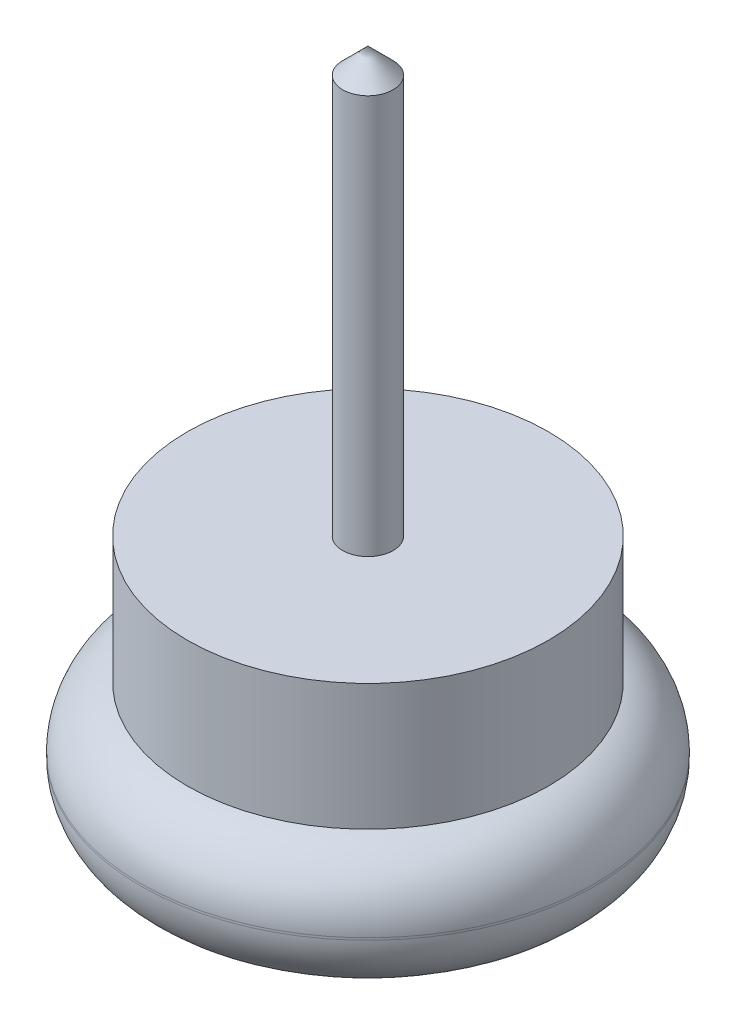
from build123d import *

# Parameters (mm, degrees)
SKETCH1_R           = 9
BOSS_EXTRUDE1_DEPTH = 5
SKETCH2_R           = 7.15
BOSS_EXTRUDE2_DEPTH = 5
SKETCH3_R           = 1
BOSS_EXTRUDE3_DEPTH = 16.8
FILLET1_R           = 2.5
CHAMFER1_SIZE       = 1


with BuildPart() as part:
    # Sketch1 → Boss-Extrude1 (new body)
    with BuildSketch(Plane(origin=(0, 0, 0), x_dir=(1, 0, 0), z_dir=(0, 1, 0))):
        with Locations(Location((0, 0, 0), (0, 0, 270))):
            Circle(SKETCH1_R)
    extrude(amount=BOSS_EXTRUDE1_DEPTH)

    # Sketch2 → Boss-Extrude2 (add)
    with BuildSketch(Plane(origin=(0, 5, 0), x_dir=(1, 0, 0), z_dir=(0, 1, 0))):
        with Locations(Location((0, 0, 0), (0, 0, 270))):
            Circle(SKETCH2_R)
    extrude(amount=BOSS_EXTRUDE2_DEPTH)

    # Sketch3 → Boss-Extrude3 (add)
    with BuildSketch(Plane(origin=(0, 10, 0), x_dir=(1, 0, 0), z_dir=(0, 1, 0))):
        with Locations(Location((0, 0, 0), (0, 0, 270))):
            Circle(SKETCH3_R)
    extrude(amount=BOSS_EXTRUDE3_DEPTH)

    # Fillet1
    # the kernel refuses this fillet: 2.5 mm, written as the material it takes off along each edge
    with BuildSketch(Plane(origin=(0, 0, 0), x_dir=(0, 0, 1), z_dir=(-1, 0, 0))) as fillet1_piece_1:
        with BuildLine():
            CenterArc((9 - FILLET1_R, FILLET1_R), FILLET1_R, 270, 90)
            Line((9 - FILLET1_R, 0), (9 - FILLET1_R, -FILLET1_R * 0.02))
            Line((9 - FILLET1_R, -FILLET1_R * 0.02), (9 + FILLET1_R * 0.02, -FILLET1_R * 0.02))
            Line((9 + FILLET1_R * 0.02, -FILLET1_R * 0.02), (9 + FILLET1_R * 0.02, FILLET1_R))
            Line((9 + FILLET1_R * 0.02, FILLET1_R), (9, FILLET1_R))
        make_face()
    revolve(axis=Axis((0, 0, 0), (0, 1, 0)), mode=Mode.SUBTRACT)
    with BuildSketch(Plane(origin=(0, 5, 0), x_dir=(0, 0, 1), z_dir=(-1, 0, 0))) as fillet1_piece_2:
        with BuildLine():
            CenterArc((6.5, -2.414021541), FILLET1_R, 0, 74.929937855)
            Line((7.15, 0), (7.163, 0.048280431))
            ThreePointArc((7.163, 0.048280431), (8.075, 0.05), (9, 0.05))
            Line((9, 0.05), (9.05, 0))
            Line((9.05, 0), (9.05, -2.414021541))
            Line((9.05, -2.414021541), (9, -2.414021541))
        make_face()
    revolve(axis=Axis((0, 5, 0), (0, 1, 0)), mode=Mode.SUBTRACT)

    # Chamfer1
    chamfer1_edges = [part.edges().sort_by_distance(p)[0] for p in [
        (0, 26.8, -1),
    ]]
    chamfer(chamfer1_edges, length=CHAMFER1_SIZE)


solid = part.part
